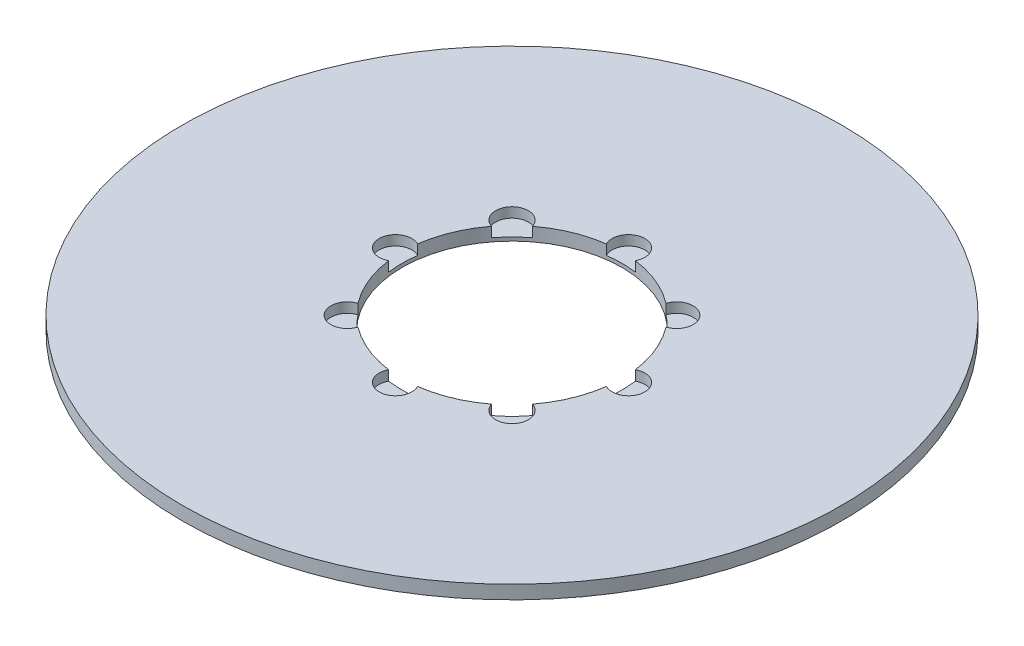
from build123d import *

# Parameters (mm, degrees)
SKETCH1_R           = 97.5
BOSS_EXTRUDE1_DEPTH = 4
SKETCH2_R           = 32.5
CUT_EXTRUDE1_DEPTH  = 138.943829148
SKETCH3_R           = 4.835188449
CUT_EXTRUDE2_DEPTH  = 2.934716604
CIRPATTERN1_COUNT   = 8


with BuildPart() as part:
    # Sketch1 → Boss-Extrude1 (new body)
    with BuildSketch(Plane(origin=(0, 0, 0), x_dir=(1, 0, 0), z_dir=(0, 1, 0))):
        Circle(SKETCH1_R)
    extrude(amount=BOSS_EXTRUDE1_DEPTH)

    # Sketch2 → Cut-Extrude1 (cut, through all)
    with BuildSketch(Plane(origin=(0, 0, 0), x_dir=(1, 0, 0), z_dir=(0, 1, 0))):
        Circle(SKETCH2_R)
    extrude(amount=CUT_EXTRUDE1_DEPTH, mode=Mode.SUBTRACT)

    # Sketch3 → Cut-Extrude2 (cut)
    with BuildSketch(Plane(origin=(0, 4, 0), x_dir=(1, 0, 0), z_dir=(0, 1, 0))):
        with Locations((-34.469203004, 0)):
            Circle(SKETCH3_R)
    cut_extrude2 = extrude(amount=-CUT_EXTRUDE2_DEPTH, mode=Mode.SUBTRACT)

    # CirPattern1: Cut-Extrude2 ×8 about axis
    cirpattern1_axis = Axis((0, 0, 0), (0, 1, 0))
    for i in range(1, CIRPATTERN1_COUNT):
        add(cut_extrude2.rotate(cirpattern1_axis, i * 360 / CIRPATTERN1_COUNT), mode=Mode.SUBTRACT)


solid = part.part
